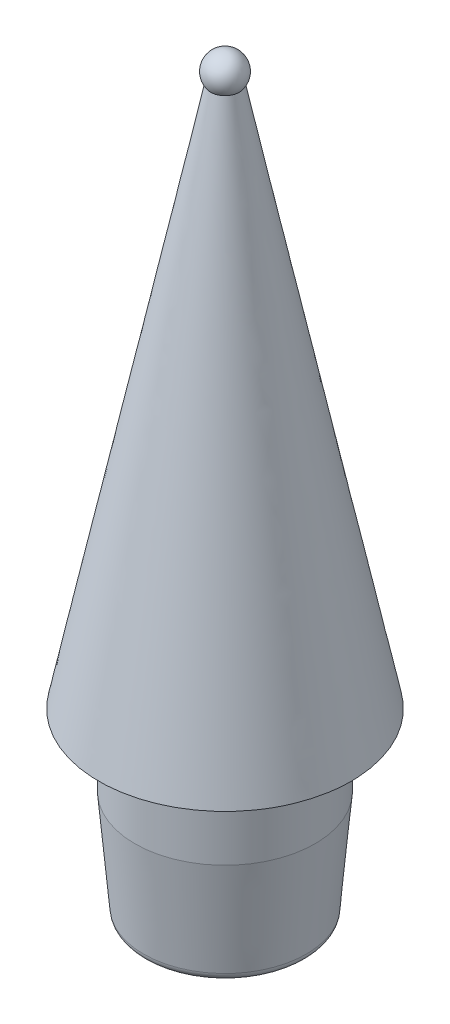
from build123d import *

# Parameters (mm, degrees)
SKETCH1_R           = 2.5
BOSS_EXTRUDE1_DEPTH = 5
SKETCH4_R           = 1.075
CUT_EXTRUDE1_DEPTH  = 13
CHAMFER1_SIZE       = 0.3
CHAMFER1_SIZE2      = 8.590875985
CHAMFER2_SIZE       = 3
CHAMFER2_SIZE2      = 0.262465991
FILLET2_R           = 0.25
FILLET4_R           = 0.25
SKETCH6_R           = 0.55
CUT_EXTRUDE2_DEPTH  = 4
FILLET5_R           = 0.1


with BuildPart() as part:
    # Sketch1 → Boss-Extrude1 (new body)
    with BuildSketch(Plane(origin=(0, 0, 0), x_dir=(1, 0, 0), z_dir=(0, 1, 0))):
        with Locations(Location((0, 0, 0), (0, 0, 270))):
            Circle(SKETCH1_R)
    extrude(amount=BOSS_EXTRUDE1_DEPTH)

    # Loft1: read off the stored shape, not the designer's step
    # Loft1: loft between two sections, ruled curve by curve
    loft1_from = [
        Edge.make_bspline([(-0.353623786, 20, -0.186949774), (0.020275763, 20, -0.894197346), (0.727523334, 20, -0.520297797), (0.353623786, 20, 0.186949774), (-0.020275763, 20, 0.894197346), (-0.727523334, 20, 0.520297797), (-0.353623786, 20, -0.186949774)], [0, 0, 0, 0, 0.5, 0.5, 0.5, 1, 1, 1, 1], 3, [1, 0.333333333, 0.333333333, 1, 0.333333333, 0.333333333, 1]),
    ]
    loft1_to = [
        Edge.make_bspline([(-3.363471416, 5, -0.968018612), (-1.427434193, 5, -7.694961444), (5.299508639, 5, -5.758924221), (3.363471416, 5, 0.968018612), (1.427434193, 5, 7.694961444), (-5.299508639, 5, 5.758924221), (-3.363471416, 5, -0.968018612)], [0, 0, 0, 0, 0.5, 0.5, 0.5, 1, 1, 1, 1], 3, [1, 0.333333333, 0.333333333, 1, 0.333333333, 0.333333333, 1]),
    ]
    loft1 = Solid(Shell([*[Face.make_surface_from_curves(loft1_from[k], loft1_to[k]) for k in range(1)], Face(Wire(loft1_from)), Face(Wire(loft1_to))]))
    add(loft1)

    # Sketch4 → Cut-Extrude1 (cut)
    with BuildSketch(Plane(origin=(0, 0, 0), x_dir=(1, 0, 0), z_dir=(0, 1, 0))):
        with Locations(Location((0, 0, 0), (0, 0, 90))):
            Circle(SKETCH4_R)
    extrude(amount=CUT_EXTRUDE1_DEPTH, mode=Mode.SUBTRACT)

    # Chamfer1
    chamfer1_edges = [part.edges().sort_by_distance(p)[0] for p in [
        (0, 0, 1.075),
    ]]
    chamfer1_side = [part.faces().sort_by_distance(p)[0] for p in [
        (0, 0, -2.429289322),
    ]]
    chamfer(chamfer1_edges, length=CHAMFER1_SIZE, length2=CHAMFER1_SIZE2, reference=chamfer1_side[0])

    # Chamfer2
    chamfer2_edges = [part.edges().sort_by_distance(p)[0] for p in [
        (0, 0, -2.5),
    ]]
    chamfer2_side = [part.faces().sort_by_distance(p)[0] for p in [
        (0, 2.5, -2.5),
    ]]
    chamfer(chamfer2_edges, length=CHAMFER2_SIZE, length2=CHAMFER2_SIZE2, reference=chamfer2_side[0])

    # Fillet2
    fillet2_edges = [part.edges().sort_by_distance(p)[0] for p in [
        (0, 5, -2.5),
    ]]
    fillet(fillet2_edges, radius=FILLET2_R)

    # Fillet4
    fillet4_edges = [part.edges().sort_by_distance(p)[0] for p in [
        (0, 0, 1.375),
        (0, 0, -2.237534009),
    ]]
    fillet(fillet4_edges, radius=FILLET4_R)

    # Sketch5 → Revolve1 (revolve)
    with BuildSketch(Plane.XY):
        with BuildLine():
            Line((0, 20.8), (0, 19.8))
            ThreePointArc((0, 19.8), (-0.5, 20.3), (0, 20.8))
        make_face()
    revolve(axis=Axis((0, 24.727188158, 0), (0, -1, 0)))

    # Sketch6 → Cut-Extrude2 (cut)
    with BuildSketch(Plane.XZ.offset(-13)):
        with Locations(Location((0, 0, 0), (0, 0, 270))):
            Circle(SKETCH6_R)
    extrude(amount=-CUT_EXTRUDE2_DEPTH, mode=Mode.SUBTRACT)

    # Fillet5
    fillet5_edges = [part.edges().sort_by_distance(p)[0] for p in [
        (0, 13, 0.55),
    ]]
    fillet(fillet5_edges, radius=FILLET5_R)


solid = part.part
